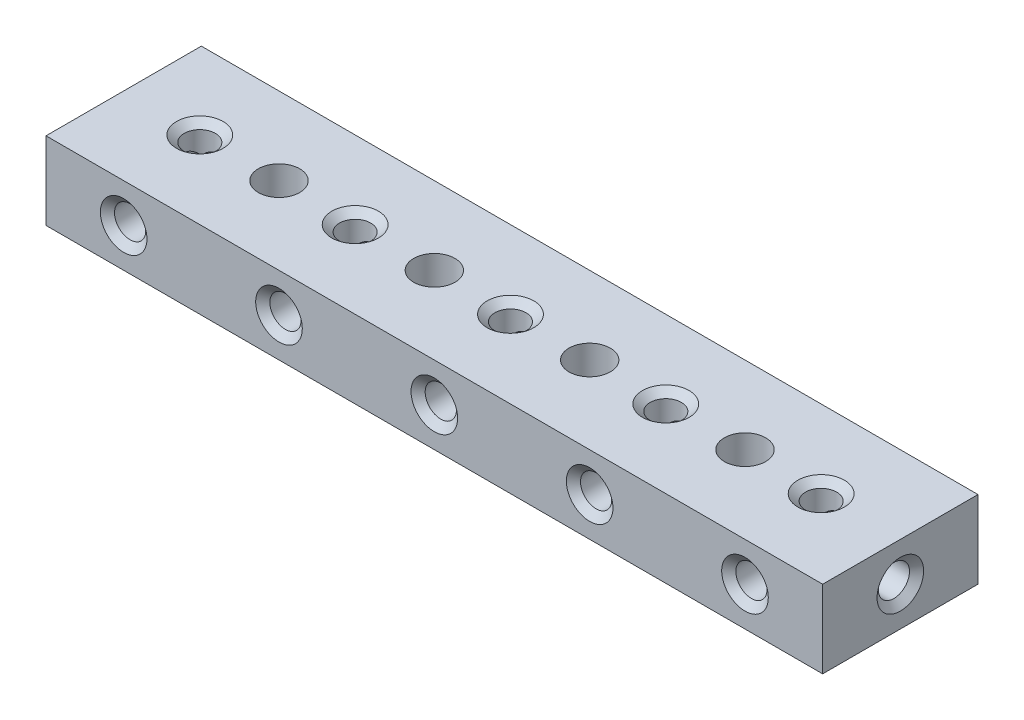
from build123d import *

# Parameters (mm, degrees)
SKETCH1_W                                            = 127
SKETCH1_H                                            = 25.4
BOSS_EXTRUDE1_DEPTH                                  = 12.7
F_1_4_20_TAPPED_HOLE1_D                              = 5.1054
F_1_4_20_TAPPED_HOLE1_CSINK_D                        = 7.62
F_1_4_20_TAPPED_HOLE1_CSINK_ANGLE                    = 100
LPATTERN1_COUNT                                      = 5
LPATTERN1_PITCH                                      = 25.4
F_1_4_20_TAPPED_HOLE2_D                              = 5.1054
F_1_4_20_TAPPED_HOLE2_CSINK_D                        = 7.62
F_1_4_20_TAPPED_HOLE2_CSINK_ANGLE                    = 100
LPATTERN2_COUNT                                      = 5
LPATTERN2_PITCH                                      = 25.4
CBORE_FOR_1_4_BINDING_HEAD_MACHINE_SCREW_D           = 6.7564
CBORE_FOR_1_4_BINDING_HEAD_MACHINE_SCREW_CBORE_D     = 14.2875
CBORE_FOR_1_4_BINDING_HEAD_MACHINE_SCREW_CBORE_DEPTH = 4.191
LPATTERN3_COUNT                                      = 4
LPATTERN3_PITCH                                      = 25.4


# Read off the part's stored shape, not the designer's step: 1/4-20 Tapped Hole3, 1/4-20 Tapped Hole4
with BuildPart() as part:
    # Sketch1 → Boss-Extrude1 (new body)
    with BuildSketch(Plane(origin=(0, 0, 0), x_dir=(1, 0, 0), z_dir=(0, 1, 0))):
        Rectangle(SKETCH1_W, SKETCH1_H)
    extrude(amount=BOSS_EXTRUDE1_DEPTH)

    # 1/4-20 Tapped Hole1 (through all)
    with Locations(Plane.XY.offset(12.7)):
        with Locations((50.8, 6.35)):
            f_1_4_20_tapped_hole1 = CounterSinkHole(F_1_4_20_TAPPED_HOLE1_D / 2, F_1_4_20_TAPPED_HOLE1_CSINK_D / 2, counter_sink_angle=F_1_4_20_TAPPED_HOLE1_CSINK_ANGLE)

    # LPattern1: 1/4-20 Tapped Hole1 ×5
    with Locations(*[(-i * LPATTERN1_PITCH, 0, 0) for i in range(1, LPATTERN1_COUNT)]):
        add(f_1_4_20_tapped_hole1, mode=Mode.SUBTRACT)

    # 1/4-20 Tapped Hole2 (through all)
    with Locations(Plane(origin=(0, 12.7, 0), x_dir=(1, 0, 0), z_dir=(0, 1, 0))):
        with Locations((50.549669318, 0)):
            f_1_4_20_tapped_hole2 = CounterSinkHole(F_1_4_20_TAPPED_HOLE2_D / 2, F_1_4_20_TAPPED_HOLE2_CSINK_D / 2, counter_sink_angle=F_1_4_20_TAPPED_HOLE2_CSINK_ANGLE)

    # LPattern2: 1/4-20 Tapped Hole2 ×5
    with Locations(*[(-i * LPATTERN2_PITCH, 0, 0) for i in range(1, LPATTERN2_COUNT)]):
        add(f_1_4_20_tapped_hole2, mode=Mode.SUBTRACT)

    # 1/4-20 Tapped Hole3 outline → 1/4-20 Tapped Hole3 (revolve, cut)
    with BuildSketch(Plane(origin=(0, 6.35, 0), x_dir=(0, 1, 0), z_dir=(0, 0, -1))):
        Polygon((0, 52.475521273), (2.5527, 52.475521273), (2.5527, 62.445000034), (3.81, 63.5), (0, 63.5), align=None)
    revolve(axis=Axis((0, 6.35, 0), (1, 0, 0)), mode=Mode.SUBTRACT)

    # 1/4-20 Tapped Hole4 outline → 1/4-20 Tapped Hole4 (revolve, cut)
    with BuildSketch(Plane(origin=(0, 6.358627193, 0), x_dir=(0, 1, 0), z_dir=(0, 0, -1))):
        Polygon((2.5527, -62.445000034), (2.5527, -52.721831611), (0, -52.721831611), (0, -63.5), (3.81, -63.5), align=None)
    revolve(axis=Axis((0, 6.358627193, 0), (1, 0, 0)), mode=Mode.SUBTRACT)

    # CBORE for 1/4 Binding Head Machine Screw1 (through all)
    with Locations(Plane(origin=(0, 0, 0), x_dir=(-1, 0, 0), z_dir=(0, -1, 0))):
        with Locations((-38.1, 0)):
            cbore_for_1_4_binding_head_machine_screw = CounterBoreHole(CBORE_FOR_1_4_BINDING_HEAD_MACHINE_SCREW_D / 2, CBORE_FOR_1_4_BINDING_HEAD_MACHINE_SCREW_CBORE_D / 2, CBORE_FOR_1_4_BINDING_HEAD_MACHINE_SCREW_CBORE_DEPTH)

    # LPattern3: CBORE for 1/4 Binding Head Machine Screw1 ×4
    with Locations(*[(-i * LPATTERN3_PITCH, 0, 0) for i in range(1, LPATTERN3_COUNT)]):
        add(cbore_for_1_4_binding_head_machine_screw, mode=Mode.SUBTRACT)


solid = part.part
